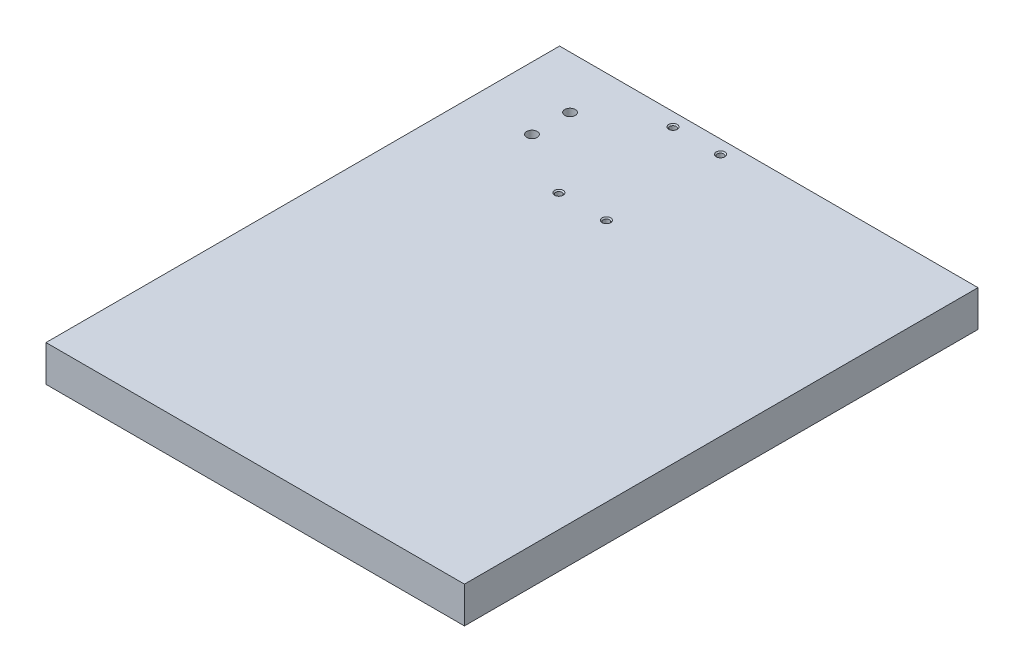
from build123d import *

# Parameters (mm, degrees)
SKETCH1_W                                           = 220
SKETCH1_H                                           = 270
BOSS_EXTRUDE1_DEPTH                                 = 19.05
M4_TAPPED_HOLE1_D                                   = 3.3
M4_TAPPED_HOLE1_DEPTH                               = 75
M4_TAPPED_HOLE1_CSINK_D                             = 4.5
M4_TAPPED_HOLE1_CSINK_ANGLE                         = 90
M4_TAPPED_HOLE1_TIP                                 = 0.991420021
CBORE_FOR_M5_HEX_SOCKET_HEAD_CAP_SCREW1_D           = 5.5
CBORE_FOR_M5_HEX_SOCKET_HEAD_CAP_SCREW1_CBORE_D     = 10
CBORE_FOR_M5_HEX_SOCKET_HEAD_CAP_SCREW1_CBORE_DEPTH = 5


with BuildPart() as part:
    # Sketch1 → Boss-Extrude1 (new body)
    with BuildSketch(Plane(origin=(0, 0, 0), x_dir=(1, 0, 0), z_dir=(0, 1, 0))):
        with Locations((110, 135)):
            Rectangle(SKETCH1_W, SKETCH1_H)
    extrude(amount=BOSS_EXTRUDE1_DEPTH)

    # M4 Tapped Hole1
    with Locations(Plane(origin=(0, 19.05, 0), x_dir=(-1, 0, 0), z_dir=(0, 1, 0))):
        with Locations((-66.64, -263), (-91.64, -263), (-91.64, -203), (-66.64, -203)):
            CounterSinkHole(M4_TAPPED_HOLE1_D / 2, M4_TAPPED_HOLE1_CSINK_D / 2, depth=M4_TAPPED_HOLE1_DEPTH, counter_sink_angle=M4_TAPPED_HOLE1_CSINK_ANGLE)
            with Locations((0, 0, -(M4_TAPPED_HOLE1_DEPTH + M4_TAPPED_HOLE1_TIP / 2))):  # 118° drill point
                Cone(0, M4_TAPPED_HOLE1_D / 2, M4_TAPPED_HOLE1_TIP, mode=Mode.SUBTRACT)

    # CBORE for M5 Hex Socket Head Cap Screw1 (through all)
    with Locations(Plane.XZ):
        with Locations((33, -242.5), (33, -222.5)):
            CounterBoreHole(CBORE_FOR_M5_HEX_SOCKET_HEAD_CAP_SCREW1_D / 2, CBORE_FOR_M5_HEX_SOCKET_HEAD_CAP_SCREW1_CBORE_D / 2, CBORE_FOR_M5_HEX_SOCKET_HEAD_CAP_SCREW1_CBORE_DEPTH)


solid = part.part
